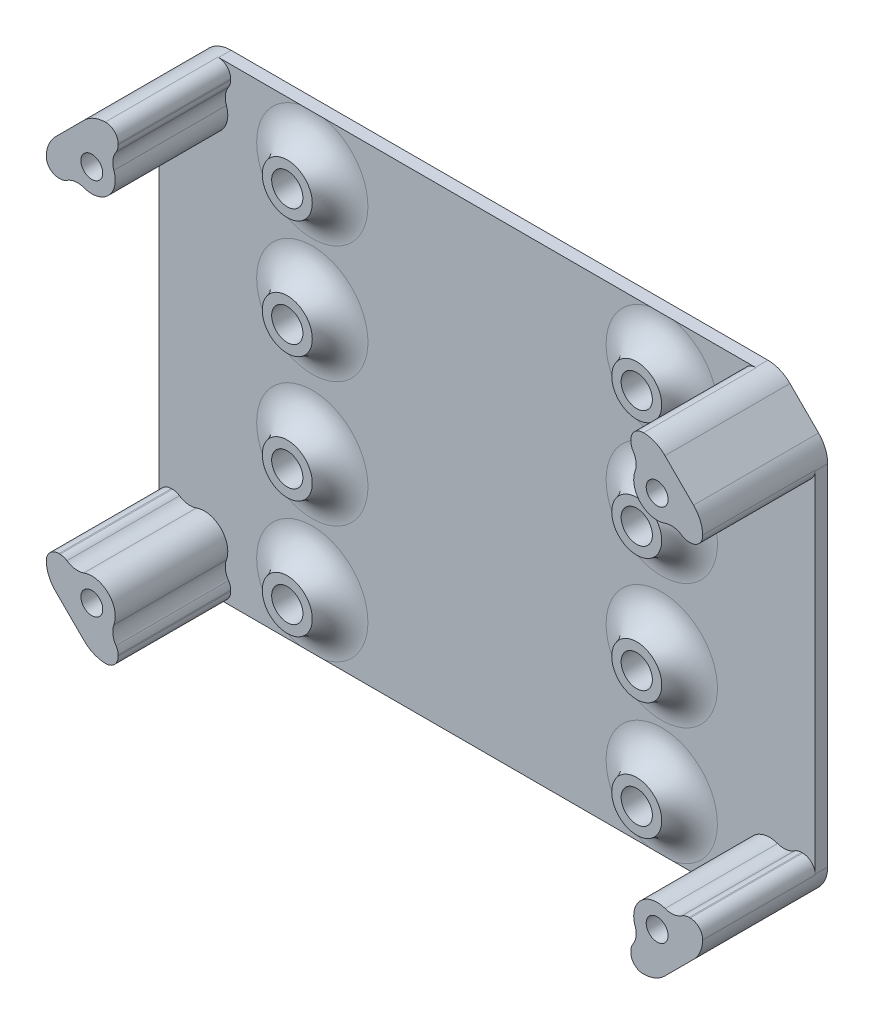
from build123d import *

# Parameters (mm, degrees)
EXTRUDE_1_DEPTH     = 20
SKETCH_2_R          = 1.75
CUT_EXTRUDE_1_DEPTH = 34
SHELL_1_T           = -2
FILLET_1_R          = 10
FILLET_2_R          = 3
FILLET_3_R          = 5
SKETCH_4_W          = 82
SKETCH_4_H          = 126.745531776
CUT_EXTRUDE_2_DEPTH = 18
FILLET_4_R          = 2
CUT_EXTRUDE_START   = -18
SKETCH_5_W          = 173.89587329
SKETCH_5_H          = 52
CUT_EXTRUDE_3_DEPTH = 18
FILLET_5_R          = 2
SKETCH_6_R          = 4
EXTRUDE_2_DEPTH     = 4
FILLET_6_R          = 5
SKETCH_7_R          = 2.5
CUT_EXTRUDE_4_DEPTH = 6


with BuildPart() as part:
    # Эскиз1 → Бобышка-Вытянуть1 (new body)
    with BuildSketch(Plane.XY):
        Polygon((-52.5, 30), (-45, 37.5), (45, 37.5), (52.5, 30), (52.5, -30), (45, -37.5), (-45, -37.5), (-52.5, -30), align=None)
    extrude(amount=EXTRUDE_1_DEPTH)

    # Эскиз2 → Вырез-Вытянуть1 (cut)
    with BuildSketch(Plane.XY.offset(20)):
        with Locations((-45.214466094, 30.214466094)):
            Circle(SKETCH_2_R)
        with Locations(Location((45.214466094, 30.214466094, 0), (0, 0, 180))):
            Circle(SKETCH_2_R)
        with Locations((45.214466094, -30.214466094)):
            Circle(SKETCH_2_R)
        with Locations(Location((-45.214466094, -30.214466094, 0), (0, 0, 180))):
            Circle(SKETCH_2_R)
    extrude(amount=-CUT_EXTRUDE_1_DEPTH, mode=Mode.SUBTRACT)

    # Оболочка1
    shell_1_openings = [part.faces().sort_by_distance(p)[0] for p in [
        (0, 0, 20),
    ]]
    offset(amount=SHELL_1_T, openings=shell_1_openings, kind=Kind.INTERSECTION)

    # Скругление1
    # the kernel refuses this fillet: 10 mm, written as the material it adds along each edge
    with BuildSketch(Plane(origin=(-45.74479618, -33.926776695, 2), x_dir=(0.7071067811865442, -0.7071067811865507, 0), z_dir=(0, 0, 1)), Plane(origin=(48.926776695, -30.74479618, 2), x_dir=(0.7071067811865482, 0.7071067811865467, 0), z_dir=(0, 0, 1)), Plane(origin=(45.74479618, 33.926776695, 2), x_dir=(-0.707106781186546, 0.7071067811865492, 0), z_dir=(0, 0, 1)), Plane(origin=(-48.926776695, 30.74479618, 2), x_dir=(-0.7071067811865508, -0.7071067811865444, 0), z_dir=(0, 0, 1))) as fillet_1_piece_1:
        with BuildLine():
            CenterArc((11.477032042, 3.794412555), FILLET_1_R, 183.312134334, 18.986942704)
            Line((1.493736012, 3.21665797), (1.294070091, 3.205102878))
            ThreePointArc((1.294070091, 3.205102878), (0.969771845, 1.504817982), (-0.12, 0.16))
            Line((-0.12, 0.16), (0, -0.2))
            ThreePointArc((0, -0.2), (1.112436867, -0.2), (2.039830568, -0.075888251))
            Line((2.039830568, -0.075888251), (2.224873734, 0))
        make_face()
    extrude(amount=18)
    with BuildSketch(Plane(origin=(-48.926776695, -30.74479618, 2), x_dir=(0.34351243985929386, 0.9391481265816991, 0), z_dir=(0, 0, 1)), Plane(origin=(45.74479618, -33.926776695, 2), x_dir=(-0.9391481265817004, 0.34351243985929, 0), z_dir=(0, 0, 1)), Plane(origin=(48.926776695, 30.74479618, 2), x_dir=(-0.3435124398592874, -0.9391481265817014, 0), z_dir=(0, 0, 1)), Plane(origin=(-45.74479618, 33.926776695, 2), x_dir=(0.9391481265817011, -0.34351243985928803, 0), z_dir=(0, 0, 1))) as fillet_1_piece_2:
        with BuildLine():
            CenterArc((8.275322434, 8.811292173), FILLET_1_R, 222.791938952, 18.986942704)
            Line((0.937067943, 2.017911495), (0.790302854, 1.882043882))
            ThreePointArc((0.790302854, 1.882043882), (0.287138375, 1.093191354), (-0.181395597, 0.084235607))
            Line((-0.181395597, 0.084235607), (0.094575114, -0.176225843))
            ThreePointArc((0.094575114, -0.176225843), (1.773283379, 0.245765435), (3.451991644, -0.176225843))
            Line((3.451991644, -0.176225843), (3.546566758, 0))
        make_face()
    extrude(amount=18)

    # Скругление2
    fillet_2_edges = [part.edges().sort_by_distance(p)[0] for p in [
        (-50.5, 29.171572875, 11),
        (-44.171572875, 35.5, 11),
        (-44.171572875, -35.5, 11),
        (-50.5, -29.171572875, 11),
        (44.171572875, -35.5, 11),
        (50.5, -29.171572875, 11),
        (50.5, 29.171572875, 11),
        (44.171572875, 35.5, 11),
    ]]
    fillet(fillet_2_edges, radius=FILLET_2_R)

    # Скругление3
    fillet_3_edges = [part.edges().sort_by_distance(p)[0] for p in [
        (45, 37.5, 10),
        (52.5, 30, 10),
        (52.5, -30, 10),
        (45, -37.5, 10),
        (-45, -37.5, 10),
        (-52.5, -30, 10),
        (-52.5, 30, 10),
        (-45, 37.5, 10),
    ]]
    fillet(fillet_3_edges, radius=FILLET_3_R)

    # Эскиз4 → Вырез-Вытянуть2 (cut)
    with BuildSketch(Plane.XY.offset(20)):
        Rectangle(SKETCH_4_W, SKETCH_4_H)
    extrude(amount=-CUT_EXTRUDE_2_DEPTH, mode=Mode.SUBTRACT)

    # Скругление4
    # the kernel refuses this fillet: 2 mm, written as the material it takes off along each edge
    with BuildSketch(Plane(origin=(41, -34.605706623, 2), x_dir=(0, -1, 0), z_dir=(0, 0, 1)), Plane(origin=(41, 34.605706623, 21.756559814), x_dir=(0, 1, 0), z_dir=(0, 0, -1))) as fillet_4_piece_1:
        with BuildLine():
            CenterArc((0.702623926, 2), FILLET_4_R, 235.828901177, 34.171098823)
            ThreePointArc((-0.420708294, 0.345272009), (-0.20250821, 0.18219615), (0, 0))
            Line((0, 0), (0.702623926, 0))
        make_face()
    extrude(amount=19.756559814, mode=Mode.SUBTRACT)
    with BuildSketch(Plane(origin=(41, -37.5, 25.118447555), x_dir=(0.9999997651545144, 0.0006853400003404547, 0), z_dir=(0, 0, -1)), Plane(origin=(-41, -37.5, 2), x_dir=(-0.9999997651545144, 0.0006853400003439418, 0), z_dir=(0, 0, 1)), Plane(origin=(41, 37.5, 2), x_dir=(0.9999997651545144, -0.0006853400003439394, 0), z_dir=(0, 0, 1))) as fillet_4_piece_2:
        with BuildLine():
            CenterArc((2.001370787, -1.999470741), FILLET_4_R, 88.681844886, 91.357422207)
            Line((0.001371257, -2.000841421), (-0.198628696, -2.000978489))
            Line((-0.198628696, -2.000978489), (-0.199999953, -0.000137068))
            Line((-0.199999953, -0.000137068), (-0.000137068, 0.199999953))
            ThreePointArc((-0.000137068, 0.199999953), (1.928794667, 0.201321927), (2.051979846, 0.199947074))
            Line((2.051979846, 0.199947074), (2.047379022, 0))
        make_face()
    extrude(amount=23.118447555, mode=Mode.SUBTRACT)
    with BuildSketch(Plane(origin=(-41, -34.605706623, 2), x_dir=(0, -1, 0), z_dir=(0, 0, 1))) as fillet_4_piece_3:
        with BuildLine():
            CenterArc((0.702623926, -2), FILLET_4_R, 90, 34.171098823)
            ThreePointArc((-0.420708294, -0.345272009), (-0.20250821, -0.18219615), (0, 0))
            Line((0, 0), (0.702623926, 0))
        make_face()
    extrude(amount=19.756559814, mode=Mode.SUBTRACT)
    with BuildSketch(Plane(origin=(-41, 34.605706623, 21.756559814), x_dir=(-0.6343994710236062, -0.7730053758965514, 0), z_dir=(0, 0, -1))) as fillet_4_piece_4:
        with BuildLine():
            CenterArc((0.72566687, 1.991754999), FILLET_4_R, 230.624541426, 34.171098823)
            Line((-0.543132072, 0.445744247), (0, 0))
            ThreePointArc((0, 0), (0.272125076, 0.012367502), (0.544250153, 0))
        make_face()
    extrude(amount=19.756559814, mode=Mode.SUBTRACT)
    with BuildSketch(Plane(origin=(-41, 37.5, 25.118447555), x_dir=(0, -1, 0), z_dir=(0, 0, -1))) as fillet_4_piece_5:
        with BuildLine():
            CenterArc((2.00084189, 2), FILLET_4_R, 178.642577793, 91.357422207)
            Line((0.001403151, 2.047378541), (-0.198540723, 2.052116395))
            ThreePointArc((-0.198540723, 2.052116395), (-0.2, 1.928932188), (-0.2, 0))
            Line((-0.2, 0), (0, -0.2))
            Line((0, -0.2), (2.00084189, -0.2))
            Line((2.00084189, -0.2), (2.00084189, 0))
        make_face()
    extrude(amount=23.118447555, mode=Mode.SUBTRACT)

    # Эскиз5 → Вырез-Вытянуть3 (cut)
    with BuildSketch(Plane.XY.offset(20).offset(CUT_EXTRUDE_START)):
        Rectangle(SKETCH_5_W, SKETCH_5_H)
    extrude(amount=CUT_EXTRUDE_3_DEPTH, mode=Mode.SUBTRACT)

    # Скругление5
    # the kernel refuses this fillet: 2 mm, written as the material it takes off along each edge
    with BuildSketch(Plane(origin=(49.605706623, -26, 21.756559814), x_dir=(1, 0, 0), z_dir=(0, 0, -1)), Plane(origin=(-49.605706623, -26, 2), x_dir=(-1, 0, 0), z_dir=(0, 0, 1))) as fillet_5_piece_1:
        with BuildLine():
            CenterArc((0.702623926, 2), FILLET_5_R, 235.828901177, 34.171098823)
            ThreePointArc((-0.420708294, 0.345272009), (-0.20250821, 0.18219615), (0, 0))
            Line((0, 0), (0.702623926, 0))
        make_face()
    extrude(amount=19.756559814, mode=Mode.SUBTRACT)
    with BuildSketch(Plane(origin=(52.5, -26, 25.118447555), x_dir=(-0.0006853400003439216, -0.9999997651545144, 0), z_dir=(0, 0, -1)), Plane(origin=(52.5, 26, 2), x_dir=(-0.0006853400003439287, 0.9999997651545144, 0), z_dir=(0, 0, 1)), Plane(origin=(-52.5, -26, 2), x_dir=(0.0006853400003439322, -0.9999997651545144, 0), z_dir=(0, 0, 1)), Plane(origin=(-52.5, 26, 25.118447555), x_dir=(0.0006853400003439264, 0.9999997651545144, 0), z_dir=(0, 0, -1))) as fillet_5_piece_2:
        with BuildLine():
            CenterArc((2.001370787, 1.999470741), FILLET_5_R, 179.960732907, 91.357422207)
            Line((0.001371257, 2.000841421), (-0.198628696, 2.000978489))
            Line((-0.198628696, 2.000978489), (-0.199999953, 0.000137068))
            Line((-0.199999953, 0.000137068), (-0.000137068, -0.199999953))
            ThreePointArc((-0.000137068, -0.199999953), (1.928794667, -0.201321927), (2.051979846, -0.199947074))
            Line((2.051979846, -0.199947074), (2.047379022, 0))
        make_face()
    extrude(amount=23.118447555, mode=Mode.SUBTRACT)
    with BuildSketch(Plane(origin=(49.605706623, 26, 21.756559814), x_dir=(-0.7730053758965525, 0.6343994710236047, 1.8308445150644594e-15), z_dir=(0, 0, -1))) as fillet_5_piece_3:
        with BuildLine():
            CenterArc((0.72566687, 1.991754999), FILLET_5_R, 230.624541426, 34.171098823)
            Line((-0.543132072, 0.445744247), (0, 0))
            ThreePointArc((0, 0), (0.272125076, 0.012367502), (0.544250153, 0))
        make_face()
    extrude(amount=19.756559814, mode=Mode.SUBTRACT)
    with BuildSketch(Plane(origin=(-49.605706623, 26, 2), x_dir=(-1, 0, 0), z_dir=(0, 0, 1))) as fillet_5_piece_4:
        with BuildLine():
            CenterArc((0.702623926, -2), FILLET_5_R, 90, 34.171098823)
            ThreePointArc((-0.420708294, -0.345272009), (-0.20250821, -0.18219615), (0, 0))
            Line((0, 0), (0.702623926, 0))
        make_face()
    extrude(amount=19.756559814, mode=Mode.SUBTRACT)

    # Эскиз6 → Бобышка-Вытянуть2 (add)
    with BuildSketch(Plane.XY.offset(2)):
        with Locations(Location((-27.95, 28.8, 0), (0, 0, 180))):
            Circle(SKETCH_6_R)
        with Locations(Location((27.95, 28.8, 0), (0, 0, 180))):
            Circle(SKETCH_6_R)
        with Locations(Location((27.95, 10, 0), (0, 0, 180))):
            Circle(SKETCH_6_R)
        with Locations(Location((-27.95, 10, 0), (0, 0, 180))):
            Circle(SKETCH_6_R)
        with Locations(Location((-27.95, -10, 0), (0, 0, 180))):
            Circle(SKETCH_6_R)
        with Locations(Location((27.95, -10, 0), (0, 0, 180))):
            Circle(SKETCH_6_R)
        with Locations(Location((27.95, -28.8, 0), (0, 0, 180))):
            Circle(SKETCH_6_R)
        with Locations(Location((-27.95, -28.8, 0), (0, 0, 180))):
            Circle(SKETCH_6_R)
    extrude(amount=EXTRUDE_2_DEPTH)

    # Скругление6
    # the kernel refuses this fillet: 5 mm, written as the material it adds along each edge
    with BuildSketch(Plane(origin=(-27.95, 28.8, 2), x_dir=(-1, 0, 0), z_dir=(0, 1, 0))) as fillet_6_piece_1_section:
        with BuildLine():
            CenterArc((8.898979486, 5), FILLET_6_R, 191.536959033, 78.463040967)
            Line((4, 4), (3.90202041, 3.98))
            ThreePointArc((3.90202041, 3.98), (3.9, 2), (3.9, 0))
            Line((3.9, 0), (4, -0.1))
            Line((4, -0.1), (8.898979486, -0.1))
            Line((8.898979486, -0.1), (8.898979486, 0))
        make_face()
    fillet_6_piece_1 = revolve(axis=Axis((-27.95, 28.8, 2), (0, 0, 1)), mode=Mode.PRIVATE)
    fillet_6_piece_1 = split(fillet_6_piece_1, bisect_by=Plane(origin=(-22.249530795, 37.5, 3.082640938), z_dir=(0, -1, 0)), keep=Keep.TOP, mode=Mode.PRIVATE)
    add(fillet_6_piece_1)
    with BuildSketch(Plane(origin=(27.95, 28.8, 2), x_dir=(-1, 0, 0), z_dir=(0, 1, 0))) as fillet_6_piece_2_section:
        with BuildLine():
            CenterArc((8.898979486, 5), FILLET_6_R, 191.536959033, 78.463040967)
            Line((4, 4), (3.90202041, 3.98))
            ThreePointArc((3.90202041, 3.98), (3.9, 2), (3.9, 0))
            Line((3.9, 0), (4, -0.1))
            Line((4, -0.1), (8.898979486, -0.1))
            Line((8.898979486, -0.1), (8.898979486, 0))
        make_face()
    fillet_6_piece_2 = revolve(axis=Axis((27.95, 28.8, 2), (0, 0, 1)), mode=Mode.PRIVATE)
    fillet_6_piece_2 = split(fillet_6_piece_2, bisect_by=Plane(origin=(33.650469205, 37.5, 3.082640938), z_dir=(0, -1, 0)), keep=Keep.TOP, mode=Mode.PRIVATE)
    add(fillet_6_piece_2)
    with BuildSketch(Plane(origin=(27.95, 10, 2), x_dir=(-1, 0, 0), z_dir=(0, 1, 0))) as fillet_6_piece_3:
        with BuildLine():
            CenterArc((8.898979486, 5), FILLET_6_R, 191.536959033, 78.463040967)
            Line((4, 4), (3.90202041, 3.98))
            ThreePointArc((3.90202041, 3.98), (3.9, 2), (3.9, 0))
            Line((3.9, 0), (4, -0.1))
            Line((4, -0.1), (8.898979486, -0.1))
            Line((8.898979486, -0.1), (8.898979486, 0))
        make_face()
    revolve(axis=Axis((27.95, 10, 2), (0, 0, 1)))
    with BuildSketch(Plane(origin=(-27.95, 10, 2), x_dir=(-1, 0, 0), z_dir=(0, 1, 0))) as fillet_6_piece_4:
        with BuildLine():
            CenterArc((8.898979486, 5), FILLET_6_R, 191.536959033, 78.463040967)
            Line((4, 4), (3.90202041, 3.98))
            ThreePointArc((3.90202041, 3.98), (3.9, 2), (3.9, 0))
            Line((3.9, 0), (4, -0.1))
            Line((4, -0.1), (8.898979486, -0.1))
            Line((8.898979486, -0.1), (8.898979486, 0))
        make_face()
    revolve(axis=Axis((-27.95, 10, 2), (0, 0, 1)))
    with BuildSketch(Plane(origin=(-27.95, -10, 2), x_dir=(-1, 0, 0), z_dir=(0, 1, 0))) as fillet_6_piece_5:
        with BuildLine():
            CenterArc((8.898979486, 5), FILLET_6_R, 191.536959033, 78.463040967)
            Line((4, 4), (3.90202041, 3.98))
            ThreePointArc((3.90202041, 3.98), (3.9, 2), (3.9, 0))
            Line((3.9, 0), (4, -0.1))
            Line((4, -0.1), (8.898979486, -0.1))
            Line((8.898979486, -0.1), (8.898979486, 0))
        make_face()
    revolve(axis=Axis((-27.95, -10, 2), (0, 0, 1)))
    with BuildSketch(Plane(origin=(27.95, -10, 2), x_dir=(-1, 0, 0), z_dir=(0, 1, 0))) as fillet_6_piece_6:
        with BuildLine():
            CenterArc((8.898979486, 5), FILLET_6_R, 191.536959033, 78.463040967)
            Line((4, 4), (3.90202041, 3.98))
            ThreePointArc((3.90202041, 3.98), (3.9, 2), (3.9, 0))
            Line((3.9, 0), (4, -0.1))
            Line((4, -0.1), (8.898979486, -0.1))
            Line((8.898979486, -0.1), (8.898979486, 0))
        make_face()
    revolve(axis=Axis((27.95, -10, 2), (0, 0, 1)))
    with BuildSketch(Plane(origin=(27.95, -28.8, 2), x_dir=(-1, 0, 0), z_dir=(0, 1, 0))) as fillet_6_piece_7_section:
        with BuildLine():
            CenterArc((8.898979486, 5), FILLET_6_R, 191.536959033, 78.463040967)
            Line((4, 4), (3.90202041, 3.98))
            ThreePointArc((3.90202041, 3.98), (3.9, 2), (3.9, 0))
            Line((3.9, 0), (4, -0.1))
            Line((4, -0.1), (8.898979486, -0.1))
            Line((8.898979486, -0.1), (8.898979486, 0))
        make_face()
    fillet_6_piece_7 = revolve(axis=Axis((27.95, -28.8, 2), (0, 0, 1)), mode=Mode.PRIVATE)
    fillet_6_piece_7 = split(fillet_6_piece_7, bisect_by=Plane(origin=(33.65046921, -37.5, 3.082640943), z_dir=(0, 1, 0)), keep=Keep.TOP, mode=Mode.PRIVATE)
    add(fillet_6_piece_7)
    with BuildSketch(Plane(origin=(-27.95, -28.8, 2), x_dir=(-1, 0, 0), z_dir=(0, 1, 0))) as fillet_6_piece_8_section:
        with BuildLine():
            CenterArc((8.898979486, 5), FILLET_6_R, 191.536959033, 78.463040967)
            Line((4, 4), (3.90202041, 3.98))
            ThreePointArc((3.90202041, 3.98), (3.9, 2), (3.9, 0))
            Line((3.9, 0), (4, -0.1))
            Line((4, -0.1), (8.898979486, -0.1))
            Line((8.898979486, -0.1), (8.898979486, 0))
        make_face()
    fillet_6_piece_8 = revolve(axis=Axis((-27.95, -28.8, 2), (0, 0, 1)), mode=Mode.PRIVATE)
    fillet_6_piece_8 = split(fillet_6_piece_8, bisect_by=Plane(origin=(-22.24953079, -37.5, 3.082640943), z_dir=(0, 1, 0)), keep=Keep.TOP, mode=Mode.PRIVATE)
    add(fillet_6_piece_8)

    # Эскиз7 → Вырез-Вытянуть4 (cut)
    with BuildSketch(Plane.XY.offset(6)):
        with Locations((-27.95, 28.8)):
            Circle(SKETCH_7_R)
        with Locations((27.95, 28.8)):
            Circle(SKETCH_7_R)
        with Locations((27.95, 10)):
            Circle(SKETCH_7_R)
        with Locations((-27.95, 10)):
            Circle(SKETCH_7_R)
        with Locations((-27.95, -10)):
            Circle(SKETCH_7_R)
        with Locations((27.95, -10)):
            Circle(SKETCH_7_R)
        with Locations((27.95, -28.8)):
            Circle(SKETCH_7_R)
        with Locations((-27.95, -28.8)):
            Circle(SKETCH_7_R)
    extrude(amount=-CUT_EXTRUDE_4_DEPTH, mode=Mode.SUBTRACT)


solid = part.part
